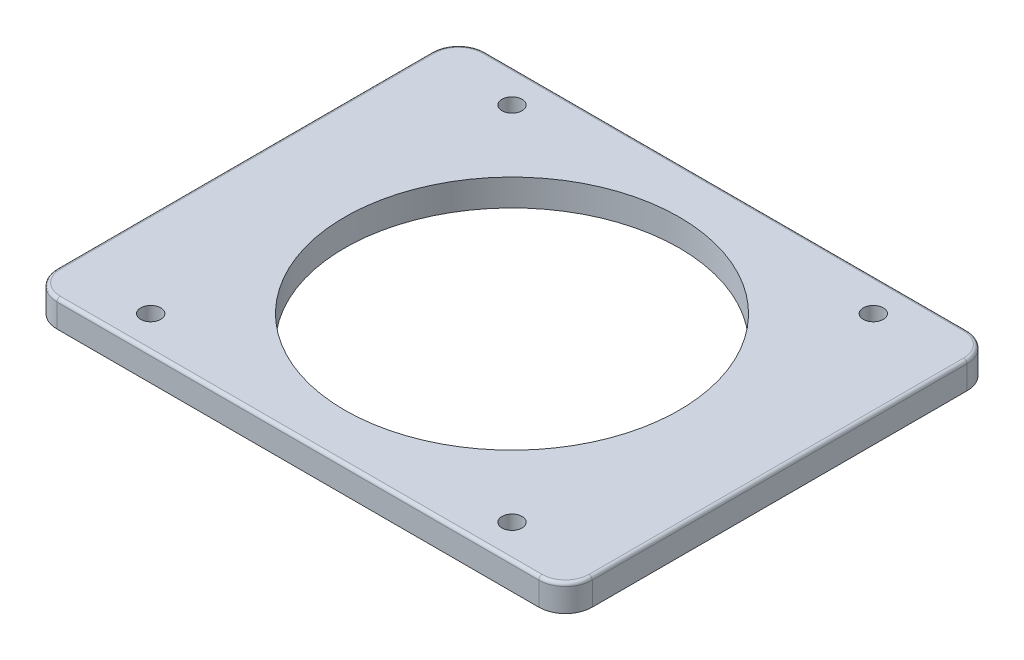
from build123d import *

# Parameters (mm, degrees)
SKETCH1_W           = 40
SKETCH1_H           = 32
SKETCH1_R           = 12.5
SKETCH1_R_2         = 0.75
BOSS_EXTRUDE1_DEPTH = 2
FILLET1_R           = 0.25
FILLET2_R           = 2


with BuildPart() as part:
    # Sketch1 → Boss-Extrude1 (new body)
    with BuildSketch(Plane(origin=(0, 0, 0), x_dir=(1, 0, 0), z_dir=(0, 1, 0))):
        Rectangle(SKETCH1_W, SKETCH1_H)
        with Locations(Location((0, 0, 0), (0, 0, 270))):
            Circle(SKETCH1_R, mode=Mode.SUBTRACT)
        with Locations(Location((-13.5, 13.5, 0), (0, 0, 270))):
            Circle(SKETCH1_R_2, mode=Mode.SUBTRACT)
        with Locations(Location((13.5, 13.5, 0), (0, 0, 270))):
            Circle(SKETCH1_R_2, mode=Mode.SUBTRACT)
        with Locations(Location((13.5, -13.5, 0), (0, 0, 270))):
            Circle(SKETCH1_R_2, mode=Mode.SUBTRACT)
        with Locations(Location((-13.5, -13.5, 0), (0, 0, 270))):
            Circle(SKETCH1_R_2, mode=Mode.SUBTRACT)
    extrude(amount=BOSS_EXTRUDE1_DEPTH)

    # Fillet1
    fillet1_edges = [part.edges().sort_by_distance(p)[0] for p in [
        (-20, 2, 0),
        (0, 2, 16),
        (20, 2, 0),
        (0, 2, -16),
    ]]
    fillet(fillet1_edges, radius=FILLET1_R)

    # Fillet2
    # the kernel refuses this fillet: 2 mm, written as the material it takes off along each edge
    with BuildSketch(Plane(origin=(-18, 2, 14), x_dir=(-1, 0, 0), z_dir=(0, 0, -1))) as fillet2_piece_1:
        with BuildLine():
            CenterArc((1.75, -0.25), 0.25, 0, 90)
            Line((2, -0.25), (2, 0))
            Line((2, 0), (1.75, 0))
        make_face()
    revolve(axis=Axis((-18, 2, 14), (0, 1, 0)), revolution_arc=90, mode=Mode.SUBTRACT)
    with BuildSketch(Plane(origin=(-18, 2, -14), x_dir=(0, 0, -1), z_dir=(1, 0, 0))) as fillet2_piece_2:
        with BuildLine():
            CenterArc((1.75, -0.25), 0.25, 0, 90)
            Line((2, -0.25), (2, 0))
            Line((2, 0), (1.75, 0))
        make_face()
    revolve(axis=Axis((-18, 2, -14), (0, 1, 0)), revolution_arc=90, mode=Mode.SUBTRACT)
    with BuildSketch(Plane(origin=(18, 2, 14), x_dir=(0, 0, 1), z_dir=(-1, 0, 0))) as fillet2_piece_3:
        with BuildLine():
            CenterArc((1.75, -0.25), 0.25, 0, 90)
            Line((2, -0.25), (2, 0))
            Line((2, 0), (1.75, 0))
        make_face()
    revolve(axis=Axis((18, 2, 14), (0, 1, 0)), revolution_arc=90, mode=Mode.SUBTRACT)
    with BuildSketch(Plane(origin=(18, 2, -14), x_dir=(1, 0, 0), z_dir=(0, 0, 1))) as fillet2_piece_4:
        with BuildLine():
            CenterArc((1.75, -0.25), 0.25, 0, 90)
            Line((2, -0.25), (2, 0))
            Line((2, 0), (1.75, 0))
        make_face()
    revolve(axis=Axis((18, 2, -14), (0, 1, 0)), revolution_arc=90, mode=Mode.SUBTRACT)
    with BuildSketch(Plane(origin=(20, -5, -16), x_dir=(0, 0, 1), z_dir=(0, 1, 0)), Plane(origin=(20, -5, 16), x_dir=(-1, 0, 0), z_dir=(0, 1, 0))) as fillet2_piece_5:
        with BuildLine():
            CenterArc((FILLET2_R, -FILLET2_R), FILLET2_R, 90, 90)
            Line((0, -FILLET2_R), (0, 0))
            Line((0, 0), (FILLET2_R, 0))
        make_face()
    extrude(amount=7, mode=Mode.SUBTRACT)
    with BuildSketch(Plane(origin=(-20, -5, -16), x_dir=(0, 0, 1), z_dir=(0, 1, 0)), Plane(origin=(-20, -5, 16), x_dir=(1, 0, 0), z_dir=(0, 1, 0))) as fillet2_piece_6:
        with BuildLine():
            CenterArc((FILLET2_R, FILLET2_R), FILLET2_R, 180, 90)
            Line((0, FILLET2_R), (0, 0))
            Line((0, 0), (FILLET2_R, 0))
        make_face()
    extrude(amount=7, mode=Mode.SUBTRACT)


solid = part.part
